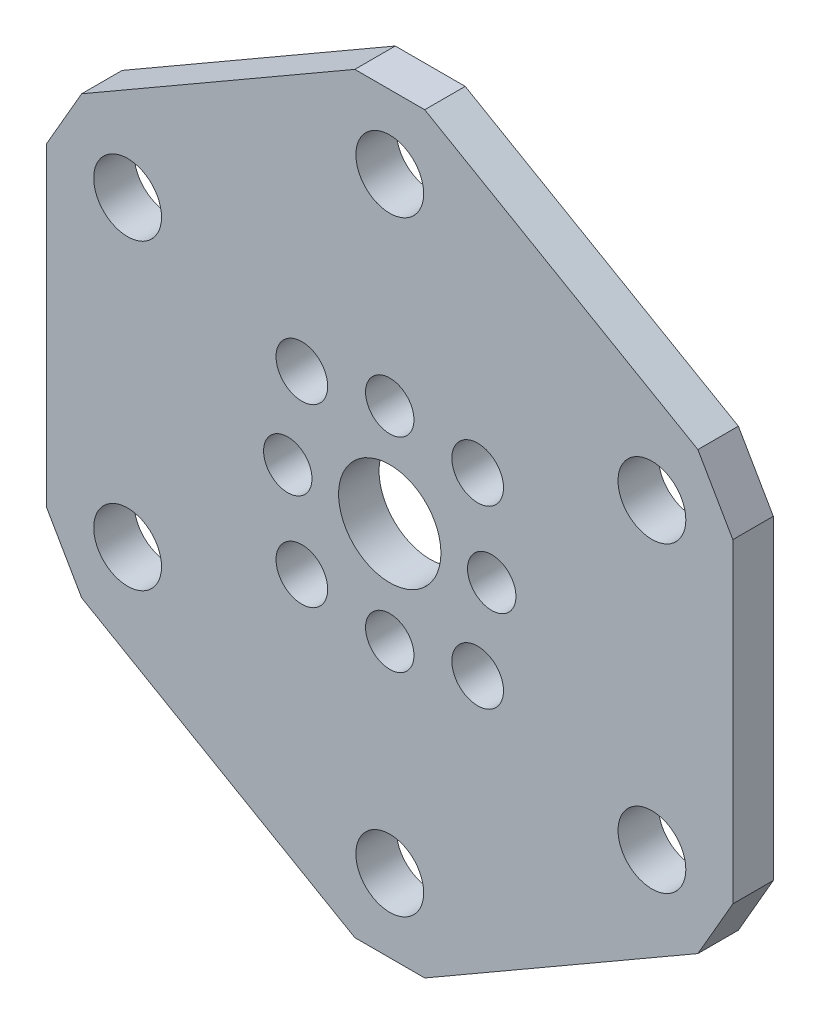
from build123d import *

# Parameters (mm, degrees)
SKETCH1_R           = 2.66
SKETCH1_R_2         = 4.014435696
SKETCH1_R_3         = 2.026666667
SKETCH1_R_4         = 1.89865
BOSS_EXTRUDE1_DEPTH = 3.175


with BuildPart() as part:
    # Sketch1 → Boss-Extrude1 (new body)
    with BuildSketch(Plane(origin=(0, 0, 0), x_dir=(-1, 0, 0), z_dir=(0, 0, -1))):
        Polygon((2.742413779, 29.497356158), (-2.742413779, 29.497356158), (-24.174252888, 17.123678079), (-26.916666667, 12.373678079), (-26.916666667, -12.373678079), (-24.174252888, -17.123678079), (-2.742413779, -29.497356158), (2.742413779, -29.497356158), (24.174252888, -17.123678079), (26.916666667, -12.373678079), (26.916666667, 12.373678079), (24.174252888, 17.123678079), align=None)
        with Locations((20.56810334, 11.875)):
            Circle(SKETCH1_R, mode=Mode.SUBTRACT)
        with Locations((20.56810334, -11.875)):
            Circle(SKETCH1_R, mode=Mode.SUBTRACT)
        with Locations((0, -23.75)):
            Circle(SKETCH1_R, mode=Mode.SUBTRACT)
        with Locations((0, 23.75)):
            Circle(SKETCH1_R, mode=Mode.SUBTRACT)
        Circle(SKETCH1_R_2, mode=Mode.SUBTRACT)
        with Locations((-20.56810334, -11.875)):
            Circle(SKETCH1_R, mode=Mode.SUBTRACT)
        with Locations((-20.56810334, 11.875)):
            Circle(SKETCH1_R, mode=Mode.SUBTRACT)
        with Locations((-6.896648139, 6.896648139)):
            Circle(SKETCH1_R_3, mode=Mode.SUBTRACT)
        with Locations((-6.896648139, -6.896648139)):
            Circle(SKETCH1_R_3, mode=Mode.SUBTRACT)
        with Locations((6.896648139, -6.896648139)):
            Circle(SKETCH1_R_3, mode=Mode.SUBTRACT)
        with Locations((6.896648139, 6.896648139)):
            Circle(SKETCH1_R_3, mode=Mode.SUBTRACT)
        with Locations((-8, 0)):
            Circle(SKETCH1_R_4, mode=Mode.SUBTRACT)
        with Locations((0, 8)):
            Circle(SKETCH1_R_4, mode=Mode.SUBTRACT)
        with Locations((8, 0)):
            Circle(SKETCH1_R_4, mode=Mode.SUBTRACT)
        with Locations((0, -8)):
            Circle(SKETCH1_R_4, mode=Mode.SUBTRACT)
    extrude(amount=-BOSS_EXTRUDE1_DEPTH)


solid = part.part
